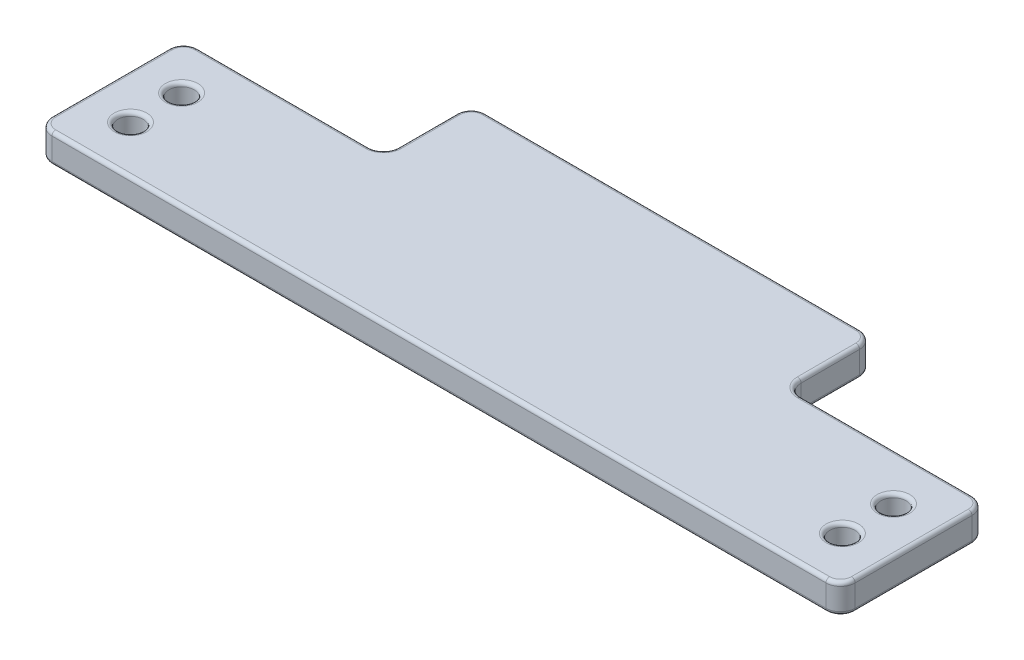
from build123d import *

# Parameters (mm, degrees)
SKETCH1_R                           = 1.325
BOSS_EXTRUDE1_DEPTH                 = 10
SKETCH2_W                           = 20
SKETCH2_H                           = 5.5
BOSS_EXTRUDE2_DEPTH                 = 55
TAP_DRILL_FOR_8_32_TAP1_D           = 3.4544
TAP_DRILL_FOR_8_32_TAP1_CSINK_D     = 4.7244
TAP_DRILL_FOR_8_32_TAP1_CSINK_ANGLE = 90
MIRROR2_COPY_1_D                    = 3.4544
MIRROR2_COPY_1_CSINK_D              = 4.7244
MIRROR2_COPY_1_CSINK_ANGLE          = 90
SKETCH6_W                           = 20
SKETCH6_H                           = 4.85
BOSS_EXTRUDE3_DEPTH                 = 6.5
SKETCH7_W                           = 55.2
SKETCH7_H                           = 5.5
BOSS_EXTRUDE4_DEPTH                 = 12
SKETCH9_R                           = 1.7272
BOSS_EXTRUDE5_DEPTH                 = 4
FILLET4_R                           = 3
FILLET1_R                           = 2
FILLET5_R                           = 1.25
FILLET2_R                           = 1
FILLET6_R                           = 1
SPLIT1_SURFACE_1_BACK               = 123.936
SPLIT1_SURFACE_1_DEPTH              = 247.872
SPLIT1_SURFACE_2_BACK               = 123.936
SPLIT1_SURFACE_2_DEPTH              = 247.872
FILLET7_R                           = 2
FILLET8_R                           = 0.5


with BuildPart() as part:
    # Sketch1 → Boss-Extrude1 (new, symmetric)
    with BuildSketch(Plane.XY):
        Polygon((-42.5, -20.25), (42.5, -20.25), (42.5, 20.25), (32.6, 20.25), (32.6, -14.75), (-32.6, -14.75), (-32.6, 20.25), (-42.5, 20.25), align=None)
        with Locations((-37.5, 8.649817683)):
            Circle(SKETCH1_R, mode=Mode.SUBTRACT)
        with Locations((-37.5, -8.350182317)):
            Circle(SKETCH1_R, mode=Mode.SUBTRACT)
        with Locations(Location((37.5, -8.350182317, 0), (0, 0, 180))):
            Circle(SKETCH1_R, mode=Mode.SUBTRACT)
        with Locations(Location((37.5, 8.649817683, 0), (0, 0, 180))):
            Circle(SKETCH1_R, mode=Mode.SUBTRACT)
    extrude(amount=BOSS_EXTRUDE1_DEPTH, both=True)

    # Sketch2 → Boss-Extrude2 (add, symmetric)
    with BuildSketch(Plane(origin=(0, 0, 0), x_dir=(0, 0, -1), z_dir=(1, 0, 0))):
        with Locations((0, -17.5)):
            Rectangle(SKETCH2_W, SKETCH2_H)
    extrude(amount=BOSS_EXTRUDE2_DEPTH, both=True)

    # Tap Drill for #8-32 Tap1 (through all)
    with Locations(Plane(origin=(-48.75, -14.75, -3.5), x_dir=(0, 0, 1), z_dir=(0, 1, 0))):
        with Locations((0, 0)):
            tap_drill_for_8_32_tap1 = CounterSinkHole(TAP_DRILL_FOR_8_32_TAP1_D / 2, TAP_DRILL_FOR_8_32_TAP1_CSINK_D / 2, counter_sink_angle=TAP_DRILL_FOR_8_32_TAP1_CSINK_ANGLE)

    # Mirror1: Tap Drill for #8-32 Tap1 across plane
    add(tap_drill_for_8_32_tap1.mirror(Plane.XY), mode=Mode.SUBTRACT)

    # Mirror2: Tap Drill for #8-32 Tap1 across plane
    add(tap_drill_for_8_32_tap1.mirror(Plane(origin=(0, 0, 0), x_dir=(0, 0, 1), z_dir=(1, 0, 0))), mode=Mode.SUBTRACT)

    # Mirror2 copy 1 (through all)
    with Locations(Plane(origin=(48.75, -14.75, 3.5), x_dir=(0, 0, -1), z_dir=(0, 1, 0))):
        with Locations((0, 0)):
            CounterSinkHole(MIRROR2_COPY_1_D / 2, MIRROR2_COPY_1_CSINK_D / 2, counter_sink_angle=MIRROR2_COPY_1_CSINK_ANGLE)

    # Sketch6 → Boss-Extrude3 (add)
    with BuildSketch(Plane(origin=(-32.6, 0, 0), x_dir=(0, 0, -1), z_dir=(1, 0, 0))):
        with Locations((0, 17.825)):
            Rectangle(SKETCH6_W, SKETCH6_H)
    boss_extrude3 = extrude(amount=BOSS_EXTRUDE3_DEPTH)

    # Mirror3: Boss-Extrude3 across plane
    add(boss_extrude3.mirror(Plane(origin=(0, 0, 0), x_dir=(0, 0, 1), z_dir=(1, 0, 0))))

    # Sketch7 → Boss-Extrude4 (add)
    with BuildSketch(Plane(origin=(0, 0, -10), x_dir=(-1, 0, 0), z_dir=(0, 0, -1))):
        with Locations((0, -17.5)):
            Rectangle(SKETCH7_W, SKETCH7_H)
    extrude(amount=BOSS_EXTRUDE4_DEPTH)

    # Fillet4
    fillet4_edges = [part.edges().sort_by_distance(p)[0] for p in [
        (27.6, -17.5, -10),
        (-27.6, -17.5, -10),
    ]]
    fillet(fillet4_edges, radius=FILLET4_R)

    # Fillet1
    fillet1_edges = [part.edges().sort_by_distance(p)[0] for p in [
        (32.6, 15.4, 0),
        (42.5, 20.25, 0),
        (-42.5, 20.25, 0),
        (-32.6, -14.75, 0),
        (32.6, -14.75, 0),
        (-42.5, -14.75, 0),
        (-55, -14.75, 0),
        (42.5, -14.75, 0),
        (55, -14.75, 0),
        (-32.6, 15.4, 0),
    ]]
    fillet(fillet1_edges, radius=FILLET1_R)

    # Fillet5
    fillet5_edges = [part.edges().sort_by_distance(p)[0] for p in [
        (26.1, 20.25, 0),
        (26.1, 15.4, 0),
        (-26.1, 15.4, 0),
        (-26.1, 20.25, 0),
    ]]
    fillet(fillet5_edges, radius=FILLET5_R)

    # Fillet2
    fillet2_edges = [part.edges().sort_by_distance(p)[0] for p in [
        (-27.6, -20.25, -17.5),
        (0, -14.75, -22),
        (-28.478679656, -20.25, -10.878679656),
        (-42.8, -20.25, -10),
        (-55, -20.25, 0),
        (55, -20.25, 0),
    ]]
    fillet(fillet2_edges, radius=FILLET2_R)

    # Fillet6
    # the kernel refuses this fillet: 1 mm, written as the material it takes off along each edge
    with BuildSketch(Plane(origin=(-54, -19.25, -9), x_dir=(-1, 0, 0), z_dir=(0, 0, -1))) as fillet6_piece_1_section:
        Polygon((0, 0), (FILLET6_R, 0), (FILLET6_R, -FILLET6_R), (0, -FILLET6_R), align=None)
    fillet6_piece_1 = extrude(amount=FILLET6_R, mode=Mode.PRIVATE)
    fillet6_piece_1 = fillet6_piece_1 - Plane(origin=(-54, -19.25, -9), x_dir=(0.7071067811865475, 0.7071067811865475, 0), z_dir=(0, 0, -1)) * Sphere(FILLET6_R, mode=Mode.PRIVATE)
    add(fillet6_piece_1, mode=Mode.SUBTRACT)
    with BuildSketch(Plane(origin=(26.6, -19.25, -21), x_dir=(0, -1, 0), z_dir=(0, 0, -1))) as fillet6_piece_2_section:
        Polygon((0, 0), (FILLET6_R, 0), (FILLET6_R, -FILLET6_R), (0, -FILLET6_R), align=None)
    fillet6_piece_2 = extrude(amount=FILLET6_R, mode=Mode.PRIVATE)
    fillet6_piece_2 = fillet6_piece_2 - Plane(origin=(26.6, -19.25, -21), x_dir=(-0.7071067811865475, 0.7071067811865475, 0), z_dir=(0, 0, -1)) * Sphere(FILLET6_R, mode=Mode.PRIVATE)
    add(fillet6_piece_2, mode=Mode.SUBTRACT)
    with BuildSketch(Plane(origin=(27.6, -20.25, -13), x_dir=(-1, 0, 0), z_dir=(0, 0, -1)), Plane(origin=(-27.6, -14.75, -13), x_dir=(1, 0, 0), z_dir=(0, 0, -1))) as fillet6_piece_3:
        with BuildLine():
            CenterArc((FILLET6_R, FILLET6_R), FILLET6_R, 180, 90)
            Line((0, FILLET6_R), (0, 0))
            Line((0, 0), (FILLET6_R, 0))
        make_face()
    extrude(amount=8, mode=Mode.SUBTRACT)
    with BuildSketch(Plane(origin=(-26.6, -20.25, -22), x_dir=(0, 0, 1), z_dir=(1, 0, 0))) as fillet6_piece_4:
        with BuildLine():
            CenterArc((FILLET6_R, -FILLET6_R), FILLET6_R, 90, 90)
            Line((0, -FILLET6_R), (0, 0))
            Line((0, 0), (FILLET6_R, 0))
        make_face()
    extrude(amount=53.2, mode=Mode.SUBTRACT)
    with BuildSketch(Plane(origin=(30.6, -20.25, -10), x_dir=(0, 0, 1), z_dir=(1, 0, 0))) as fillet6_piece_5:
        with BuildLine():
            CenterArc((FILLET6_R, -FILLET6_R), FILLET6_R, 90, 90)
            Line((0, -FILLET6_R), (0, 0))
            Line((0, 0), (FILLET6_R, 0))
        make_face()
    extrude(amount=23.4, mode=Mode.SUBTRACT)
    with BuildSketch(Plane(origin=(30.6, -20.25, -13), x_dir=(0, 0, 1), z_dir=(1, 0, 0))) as fillet6_piece_6:
        with BuildLine():
            CenterArc((3 + FILLET6_R, -FILLET6_R), FILLET6_R, 90, 90)
            Line((3, -FILLET6_R), (3, 0))
            Line((3, 0), (3 + FILLET6_R, 0))
        make_face()
    revolve(axis=Axis((30.6, -20.25, -13), (0, -1, 0)), revolution_arc=90, mode=Mode.SUBTRACT)
    with BuildSketch(Plane(origin=(30.6, -14.75, -13), x_dir=(0, 0, 1), z_dir=(1, 0, 0))) as fillet6_piece_7:
        with BuildLine():
            CenterArc((3 + FILLET6_R, FILLET6_R), FILLET6_R, 180, 90)
            Line((3, FILLET6_R), (3, 0))
            Line((3, 0), (3 + FILLET6_R, 0))
        make_face()
    revolve(axis=Axis((30.6, -14.75, -13), (0, -1, 0)), revolution_arc=90, mode=Mode.SUBTRACT)
    with BuildSketch(Plane(origin=(-30.6, -14.75, -13), x_dir=(0, 0, 1), z_dir=(-1, 0, 0))) as fillet6_piece_8:
        with BuildLine():
            CenterArc((3 + FILLET6_R, -FILLET6_R), FILLET6_R, 90, 90)
            Line((3 + FILLET6_R, 0), (3, 0))
            Line((3, 0), (3, -FILLET6_R))
        make_face()
    revolve(axis=Axis((-30.6, -14.75, -13), (0, 1, 0)), revolution_arc=90, mode=Mode.SUBTRACT)
    with BuildSketch(Plane(origin=(-32.6, -12.75, -10), x_dir=(-1, 0, 0), z_dir=(0, 1, 0))) as fillet6_piece_9:
        with BuildLine():
            CenterArc((FILLET6_R, FILLET6_R), FILLET6_R, 180, 90)
            Line((0, FILLET6_R), (0, 0))
            Line((0, 0), (FILLET6_R, 0))
        make_face()
    extrude(amount=26.15, mode=Mode.SUBTRACT)
    with BuildSketch(Plane(origin=(32.6, 13.4, -10), x_dir=(0, 0, 1), z_dir=(0, -1, 0))) as fillet6_piece_10:
        with BuildLine():
            CenterArc((FILLET6_R, -FILLET6_R), FILLET6_R, 90, 90)
            Line((0, -FILLET6_R), (0, 0))
            Line((0, 0), (FILLET6_R, 0))
        make_face()
    extrude(amount=26.15, mode=Mode.SUBTRACT)
    with BuildSketch(Plane(origin=(44.5, -14.75, -10), x_dir=(0, 0, 1), z_dir=(1, 0, 0))) as fillet6_piece_11:
        with BuildLine():
            CenterArc((FILLET6_R, FILLET6_R), FILLET6_R, 180, 90)
            Line((0, FILLET6_R), (0, 0))
            Line((0, 0), (FILLET6_R, 0))
        make_face()
    extrude(amount=8.5, mode=Mode.SUBTRACT)
    with BuildSketch(Plane(origin=(27.35, 20.25, -10), x_dir=(0, 0, 1), z_dir=(1, 0, 0))) as fillet6_piece_12:
        with BuildLine():
            CenterArc((FILLET6_R, FILLET6_R), FILLET6_R, 180, 90)
            Line((0, FILLET6_R), (0, 0))
            Line((0, 0), (FILLET6_R, 0))
        make_face()
    extrude(amount=13.15, mode=Mode.SUBTRACT)
    with BuildSketch(Plane(origin=(42.5, -12.75, -10), x_dir=(0, 0, 1), z_dir=(0, 1, 0))) as fillet6_piece_13:
        with BuildLine():
            CenterArc((FILLET6_R, -FILLET6_R), FILLET6_R, 90, 90)
            Line((0, -FILLET6_R), (0, 0))
            Line((0, 0), (FILLET6_R, 0))
        make_face()
    extrude(amount=31, mode=Mode.SUBTRACT)
    with BuildSketch(Plane(origin=(40.5, 18.25, -10), x_dir=(1, 0, 0), z_dir=(0, -1, 0))) as fillet6_piece_14:
        with BuildLine():
            CenterArc((2 - FILLET6_R, FILLET6_R), FILLET6_R, 270, 90)
            Line((2 - FILLET6_R, 0), (2, 0))
            Line((2, 0), (2, FILLET6_R))
        make_face()
    revolve(axis=Axis((40.5, 18.25, -10), (0, 0, 1)), revolution_arc=90, mode=Mode.SUBTRACT)
    with BuildSketch(Plane(origin=(53, -16.75, -10), x_dir=(1, 0, 0), z_dir=(0, -1, 0))) as fillet6_piece_15:
        with BuildLine():
            CenterArc((2 - FILLET6_R, FILLET6_R), FILLET6_R, 270, 90)
            Line((2 - FILLET6_R, 0), (2, 0))
            Line((2, 0), (2, FILLET6_R))
        make_face()
    revolve(axis=Axis((53, -16.75, -10), (0, 0, 1)), revolution_arc=90, mode=Mode.SUBTRACT)
    with BuildSketch(Plane(origin=(-53, -14.75, -10), x_dir=(0, -1, 0), z_dir=(1, 0, 0))) as fillet6_piece_16:
        with BuildLine():
            CenterArc((FILLET6_R, -FILLET6_R), FILLET6_R, 90, 90)
            Line((0, -FILLET6_R), (0, 0))
            Line((0, 0), (FILLET6_R, 0))
        make_face()
    extrude(amount=8.5, mode=Mode.SUBTRACT)
    with BuildSketch(Plane(origin=(-42.5, 18.25, -10), x_dir=(1, 0, 0), z_dir=(0, -1, 0))) as fillet6_piece_17:
        with BuildLine():
            CenterArc((FILLET6_R, FILLET6_R), FILLET6_R, 180, 90)
            Line((0, FILLET6_R), (0, 0))
            Line((0, 0), (FILLET6_R, 0))
        make_face()
    extrude(amount=31, mode=Mode.SUBTRACT)
    with BuildSketch(Plane(origin=(-40.5, 18.25, -10), x_dir=(-1, 0, 0), z_dir=(0, -1, 0))) as fillet6_piece_18:
        with BuildLine():
            CenterArc((2 - FILLET6_R, -FILLET6_R), FILLET6_R, 0, 90)
            Line((2, -FILLET6_R), (2, 0))
            Line((2, 0), (2 - FILLET6_R, 0))
        make_face()
    revolve(axis=Axis((-40.5, 18.25, -10), (0, 0, -1)), revolution_arc=90, mode=Mode.SUBTRACT)
    with BuildSketch(Plane(origin=(-53, -16.75, -10), x_dir=(-1, 0, 0), z_dir=(0, -1, 0))) as fillet6_piece_19:
        with BuildLine():
            CenterArc((2 - FILLET6_R, -FILLET6_R), FILLET6_R, 0, 90)
            Line((2, -FILLET6_R), (2, 0))
            Line((2, 0), (2 - FILLET6_R, 0))
        make_face()
    revolve(axis=Axis((-53, -16.75, -10), (0, 0, -1)), revolution_arc=90, mode=Mode.SUBTRACT)
    with BuildSketch(Plane(origin=(-30.6, -12.75, -10), x_dir=(0, -1, 0), z_dir=(1, 0, 0))) as fillet6_piece_20:
        with BuildLine():
            CenterArc((2 + FILLET6_R, -FILLET6_R), FILLET6_R, 90, 90)
            Line((2, -FILLET6_R), (2, 0))
            Line((2, 0), (2 + FILLET6_R, 0))
        make_face()
    revolve(axis=Axis((-30.6, -12.75, -10), (0, 0, -1)), revolution_arc=90, mode=Mode.SUBTRACT)
    with BuildSketch(Plane(origin=(-30.6, 13.4, -10), x_dir=(-1, 0, 0), z_dir=(0, -1, 0))) as fillet6_piece_21:
        with BuildLine():
            CenterArc((2 + FILLET6_R, -FILLET6_R), FILLET6_R, 90, 90)
            Line((2, -FILLET6_R), (2, 0))
            Line((2, 0), (2 + FILLET6_R, 0))
        make_face()
    revolve(axis=Axis((-30.6, 13.4, -10), (0, 0, -1)), revolution_arc=90, mode=Mode.SUBTRACT)
    with BuildSketch(Plane(origin=(30.6, 13.4, -10), x_dir=(0, 1, 0), z_dir=(-1, 0, 0))) as fillet6_piece_22:
        with BuildLine():
            CenterArc((2 + FILLET6_R, -FILLET6_R), FILLET6_R, 90, 90)
            Line((2 + FILLET6_R, 0), (2, 0))
            Line((2, 0), (2, -FILLET6_R))
        make_face()
    revolve(axis=Axis((30.6, 13.4, -10), (0, 0, -1)), revolution_arc=90, mode=Mode.SUBTRACT)
    with BuildSketch(Plane(origin=(30.6, -12.75, -10), x_dir=(0, -1, 0), z_dir=(-1, 0, 0))) as fillet6_piece_23:
        with BuildLine():
            CenterArc((2 + FILLET6_R, FILLET6_R), FILLET6_R, 180, 90)
            Line((2 + FILLET6_R, 0), (2, 0))
            Line((2, 0), (2, FILLET6_R))
        make_face()
    revolve(axis=Axis((30.6, -12.75, -10), (0, 0, 1)), revolution_arc=90, mode=Mode.SUBTRACT)
    with BuildSketch(Plane(origin=(44.5, -12.75, -10), x_dir=(0, -1, 0), z_dir=(1, 0, 0))) as fillet6_piece_24:
        with BuildLine():
            CenterArc((2 + FILLET6_R, -FILLET6_R), FILLET6_R, 90, 90)
            Line((2 + FILLET6_R, 0), (2, 0))
            Line((2, 0), (2, -FILLET6_R))
        make_face()
    revolve(axis=Axis((44.5, -12.75, -10), (0, 0, -1)), revolution_arc=90, mode=Mode.SUBTRACT)
    with BuildSketch(Plane(origin=(-44.5, -12.75, -10), x_dir=(0, -1, 0), z_dir=(-1, 0, 0))) as fillet6_piece_25:
        with BuildLine():
            CenterArc((2 + FILLET6_R, FILLET6_R), FILLET6_R, 180, 90)
            Line((2, FILLET6_R), (2, 0))
            Line((2, 0), (2 + FILLET6_R, 0))
        make_face()
    revolve(axis=Axis((-44.5, -12.75, -10), (0, 0, 1)), revolution_arc=90, mode=Mode.SUBTRACT)
    with BuildSketch(Plane(origin=(-26.1, 19, -10), x_dir=(-1, 0, 0), z_dir=(0, -1, 0)), Plane(origin=(26.1, 19, -10), x_dir=(0, 0, 1), z_dir=(0, -1, 0))) as fillet6_piece_26:
        with BuildLine():
            CenterArc((FILLET6_R, -FILLET6_R), FILLET6_R, 90, 90)
            Line((0, -FILLET6_R), (0, 0))
            Line((0, 0), (FILLET6_R, 0))
        make_face()
    extrude(amount=2.35, mode=Mode.SUBTRACT)
    with BuildSketch(Plane(origin=(-40.5, 20.25, -10), x_dir=(0, -1, 0), z_dir=(1, 0, 0))) as fillet6_piece_27:
        with BuildLine():
            CenterArc((FILLET6_R, -FILLET6_R), FILLET6_R, 90, 90)
            Line((0, -FILLET6_R), (0, 0))
            Line((0, 0), (FILLET6_R, 0))
        make_face()
    extrude(amount=13.15, mode=Mode.SUBTRACT)
    with BuildSketch(Plane(origin=(-30.6, 15.4, -10), x_dir=(0, 1, 0), z_dir=(1, 0, 0)), Plane(origin=(30.6, 15.4, -10), x_dir=(0, 0, 1), z_dir=(-1, 0, 0))) as fillet6_piece_28:
        with BuildLine():
            CenterArc((FILLET6_R, FILLET6_R), FILLET6_R, 180, 90)
            Line((0, FILLET6_R), (0, 0))
            Line((0, 0), (FILLET6_R, 0))
        make_face()
    extrude(amount=3.25, mode=Mode.SUBTRACT)
    with BuildSketch(Plane(origin=(-27.35, 19, -10), x_dir=(0, 1, 0), z_dir=(-1, 0, 0))) as fillet6_piece_29:
        with BuildLine():
            CenterArc((1.25 - FILLET6_R, -FILLET6_R), FILLET6_R, 0, 90)
            Line((1.25, -FILLET6_R), (1.25, 0))
            Line((1.25, 0), (1.25 - FILLET6_R, 0))
        make_face()
    revolve(axis=Axis((-27.35, 19, -10), (0, 0, -1)), revolution_arc=90, mode=Mode.SUBTRACT)
    with BuildSketch(Plane(origin=(-27.35, 16.65, -10), x_dir=(0, -1, 0), z_dir=(-1, 0, 0))) as fillet6_piece_30:
        with BuildLine():
            CenterArc((1.25 - FILLET6_R, FILLET6_R), FILLET6_R, 270, 90)
            Line((1.25, FILLET6_R), (1.25, 0))
            Line((1.25, 0), (1.25 - FILLET6_R, 0))
        make_face()
    revolve(axis=Axis((-27.35, 16.65, -10), (0, 0, 1)), revolution_arc=90, mode=Mode.SUBTRACT)
    with BuildSketch(Plane(origin=(27.35, 19, -10), x_dir=(-1, 0, 0), z_dir=(0, -1, 0))) as fillet6_piece_31:
        with BuildLine():
            CenterArc((1.25 - FILLET6_R, -FILLET6_R), FILLET6_R, 0, 90)
            Line((1.25 - FILLET6_R, 0), (1.25, 0))
            Line((1.25, 0), (1.25, -FILLET6_R))
        make_face()
    revolve(axis=Axis((27.35, 19, -10), (0, 0, -1)), revolution_arc=90, mode=Mode.SUBTRACT)
    with BuildSketch(Plane(origin=(27.35, 16.65, -10), x_dir=(0, -1, 0), z_dir=(1, 0, 0))) as fillet6_piece_32:
        with BuildLine():
            CenterArc((1.25 - FILLET6_R, -FILLET6_R), FILLET6_R, 0, 90)
            Line((1.25 - FILLET6_R, 0), (1.25, 0))
            Line((1.25, 0), (1.25, -FILLET6_R))
        make_face()
    revolve(axis=Axis((27.35, 16.65, -10), (0, 0, -1)), revolution_arc=90, mode=Mode.SUBTRACT)
    with BuildSketch(Plane(origin=(-27.6, -15.75, -22), x_dir=(0, 0, 1), z_dir=(0, -1, 0)), Plane(origin=(27.6, -19.25, -22), x_dir=(0, 0, 1), z_dir=(0, 1, 0))) as fillet6_piece_33:
        with BuildLine():
            CenterArc((FILLET6_R, -FILLET6_R), FILLET6_R, 90, 90)
            Line((0, -FILLET6_R), (0, 0))
            Line((0, 0), (FILLET6_R, 0))
        make_face()
    extrude(amount=3.5, mode=Mode.SUBTRACT)
    with BuildSketch(Plane(origin=(-27.6, -15.75, -21), x_dir=(0, 1, 0), z_dir=(0, 0, 1))) as fillet6_piece_34:
        with BuildLine():
            CenterArc((1 - FILLET6_R, -FILLET6_R), FILLET6_R, 0, 90)
            Line((1, -FILLET6_R), (1, 0))
            Line((1, 0), (1 - FILLET6_R, 0))
        make_face()
    revolve(axis=Axis((-27.6, -15.75, -21), (-1, 0, 0)), revolution_arc=90, mode=Mode.SUBTRACT)
    with BuildSketch(Plane(origin=(-26.6, -19.25, -22), x_dir=(0, -1, 0), z_dir=(1, 0, 0))) as fillet6_piece_35:
        with BuildLine():
            CenterArc((1 - FILLET6_R, -FILLET6_R), FILLET6_R, 0, 90)
            Line((1 - FILLET6_R, 0), (1, 0))
            Line((1, 0), (1, -FILLET6_R))
        make_face()
    revolve(axis=Axis((-26.6, -19.25, -22), (0, 0, -1)), revolution_arc=90, mode=Mode.SUBTRACT)
    with BuildSketch(Plane(origin=(27.6, -14.75, -13), x_dir=(-1, 0, 0), z_dir=(0, 0, -1))) as fillet6_piece_36:
        with BuildLine():
            CenterArc((FILLET6_R, -FILLET6_R), FILLET6_R, 90, 90)
            Line((0, -FILLET6_R), (0, 0))
            Line((0, 0), (FILLET6_R, 0))
        make_face()
    extrude(amount=8, mode=Mode.SUBTRACT)
    with BuildSketch(Plane(origin=(27.6, -15.75, -21), x_dir=(0, 1, 0), z_dir=(0, 0, 1))) as fillet6_piece_37:
        with BuildLine():
            CenterArc((1 - FILLET6_R, FILLET6_R), FILLET6_R, 270, 90)
            Line((1, FILLET6_R), (1, 0))
            Line((1, 0), (1 - FILLET6_R, 0))
        make_face()
    revolve(axis=Axis((27.6, -15.75, -21), (-1, 0, 0)), revolution_arc=90, mode=Mode.SUBTRACT)
    with BuildSketch(Plane(origin=(-55, -16.75, -10), x_dir=(1, 0, 0), z_dir=(0, -1, 0)), Plane(origin=(55, -16.75, -10), x_dir=(0, 0, 1), z_dir=(0, -1, 0))) as fillet6_piece_38:
        with BuildLine():
            CenterArc((FILLET6_R, FILLET6_R), FILLET6_R, 180, 90)
            Line((0, FILLET6_R), (0, 0))
            Line((0, 0), (FILLET6_R, 0))
        make_face()
    extrude(amount=2.5, mode=Mode.SUBTRACT)
    with BuildSketch(Plane(origin=(54, -19.25, -10), x_dir=(0, -1, 0), z_dir=(-1, 0, 0))) as fillet6_piece_39:
        with BuildLine():
            CenterArc((1 - FILLET6_R, FILLET6_R), FILLET6_R, 270, 90)
            Line((1 - FILLET6_R, 0), (1, 0))
            Line((1, 0), (1, FILLET6_R))
        make_face()
    revolve(axis=Axis((54, -19.25, -10), (0, 0, 1)), revolution_arc=90, mode=Mode.SUBTRACT)


with BuildPart() as body_2:
    # Sketch9 → Boss-Extrude5 (new body)
    with BuildSketch(Plane(origin=(0, -20.35, 0), x_dir=(-1, 0, 0), z_dir=(0, -1, 0))):
        Polygon((-55, -10), (55, -10), (55, 10), (27.6, 10), (27.6, 22), (-27.6, 22), (-27.6, 10), (-55, 10), align=None)
        with Locations(Location((-48.75, -3.5, 0), (0, 0, 90))):
            Circle(SKETCH9_R, mode=Mode.SUBTRACT)
        with Locations(Location((-48.75, 3.5, 0), (0, 0, 90))):
            Circle(SKETCH9_R, mode=Mode.SUBTRACT)
        with Locations(Location((48.75, -3.5, 0), (0, 0, 90))):
            Circle(SKETCH9_R, mode=Mode.SUBTRACT)
        with Locations(Location((48.75, 3.5, 0), (0, 0, 90))):
            Circle(SKETCH9_R, mode=Mode.SUBTRACT)
    extrude(amount=BOSS_EXTRUDE5_DEPTH)

    # Fillet7
    fillet7_edges = [body_2.edges().sort_by_distance(p)[0] for p in [
        (55, -22.35, -10),
        (27.6, -22.35, -10),
        (27.6, -22.35, -22),
        (-27.6, -22.35, -22),
        (-27.6, -22.35, -10),
        (-55, -22.35, -10),
        (-55, -22.35, 10),
        (55, -22.35, 10),
    ]]
    fillet(fillet7_edges, radius=FILLET7_R)

    # Fillet8
    fillet8_edges = [body_2.edges().sort_by_distance(p)[0] for p in [
        (48.75, -20.35, 5.2272),
        (48.75, -24.35, 5.2272),
        (48.75, -20.35, -1.7728),
        (48.75, -24.35, -1.7728),
        (-48.75, -20.35, 5.2272),
        (-48.75, -24.35, 5.2272),
        (-48.75, -20.35, -1.7728),
        (-48.75, -24.35, -1.7728),
        (-55, -20.35, 0),
        (-55, -24.35, 0),
        (55, -20.35, 0),
        (41.3, -20.35, -10),
        (27.6, -20.35, -16),
        (0, -20.35, -22),
        (-27.6, -20.35, -16),
        (-41.3, -20.35, -10),
        (0, -20.35, 10),
        (54.414213562, -20.35, -9.414213562),
        (54.414213562, -20.35, 9.414213562),
        (27.014213562, -20.35, -21.414213562),
        (-27.014213562, -20.35, -21.414213562),
        (-54.414213562, -20.35, -9.414213562),
        (-54.414213562, -20.35, 9.414213562),
        (0, -24.35, 10),
        (55, -24.35, 0),
        (-41.3, -24.35, -10),
        (-27.6, -24.35, -16),
        (0, -24.35, -22),
        (27.6, -24.35, -16),
        (41.3, -24.35, -10),
        (54.414213562, -24.35, -9.414213562),
        (54.414213562, -24.35, 9.414213562),
        (27.014213562, -24.35, -21.414213562),
        (-27.014213562, -24.35, -21.414213562),
        (-54.414213562, -24.35, -9.414213562),
        (-54.414213562, -24.35, 9.414213562),
        (-28.185786438, -20.35, -10.585786438),
        (-28.185786438, -24.35, -10.585786438),
        (28.185786438, -20.35, -10.585786438),
        (28.185786438, -24.35, -10.585786438),
    ]]
    fillet(fillet8_edges, radius=FILLET8_R)


with BuildPart() as body_3:
    # Split1: the piece behind the surface
    add(part.part)
    # Split1 surface: a surface, the sketch's curves swept straight by 247.872 mm
    with BuildLine(Plane.XY.offset(10).offset(-SPLIT1_SURFACE_1_BACK), mode=Mode.PRIVATE) as split1_surface_1_path:
        Line((-27.35, 17.4), (27.35, 17.4))
        Line((27.35, 17.4), (30.6, 17.4))
        ThreePointArc((30.6, 17.4), (33.428427125, 16.228427125), (34.6, 13.4))
        Line((34.6, 13.4), (34.6, -12.75))
        ThreePointArc((34.6, -12.75), (33.428427125, -15.578427125), (30.6, -16.75))
        Line((30.6, -16.75), (-30.6, -16.75))
        ThreePointArc((-30.6, -16.75), (-33.428427125, -15.578427125), (-34.6, -12.75))
        Line((-34.6, -12.75), (-34.6, 13.4))
        ThreePointArc((-34.6, 13.4), (-33.428427125, 16.228427125), (-30.6, 17.4))
        Line((-30.6, 17.4), (-27.35, 17.4))
    split1_surface_1 = Shell.extrude(split1_surface_1_path.wire(), (0 * SPLIT1_SURFACE_1_DEPTH, 0 * SPLIT1_SURFACE_1_DEPTH, 1 * SPLIT1_SURFACE_1_DEPTH))
    split(bisect_by=split1_surface_1, keep=Keep.BOTTOM)


with BuildPart() as part_1:
    add(part.part)

    # Split1: split by a surface, the side it looks to stays
    # Split1 surface: a surface, the sketch's curves swept straight by 247.872 mm
    with BuildLine(Plane.XY.offset(10).offset(-SPLIT1_SURFACE_2_BACK), mode=Mode.PRIVATE) as split1_surface_2_path:
        Line((-27.35, 17.4), (27.35, 17.4))
        Line((27.35, 17.4), (30.6, 17.4))
        ThreePointArc((30.6, 17.4), (33.428427125, 16.228427125), (34.6, 13.4))
        Line((34.6, 13.4), (34.6, -12.75))
        ThreePointArc((34.6, -12.75), (33.428427125, -15.578427125), (30.6, -16.75))
        Line((30.6, -16.75), (-30.6, -16.75))
        ThreePointArc((-30.6, -16.75), (-33.428427125, -15.578427125), (-34.6, -12.75))
        Line((-34.6, -12.75), (-34.6, 13.4))
        ThreePointArc((-34.6, 13.4), (-33.428427125, 16.228427125), (-30.6, 17.4))
        Line((-30.6, 17.4), (-27.35, 17.4))
    split1_surface_2 = Shell.extrude(split1_surface_2_path.wire(), (0 * SPLIT1_SURFACE_2_DEPTH, 0 * SPLIT1_SURFACE_2_DEPTH, 1 * SPLIT1_SURFACE_2_DEPTH))
    split(bisect_by=split1_surface_2, keep=Keep.TOP)


solid = body_2.part
